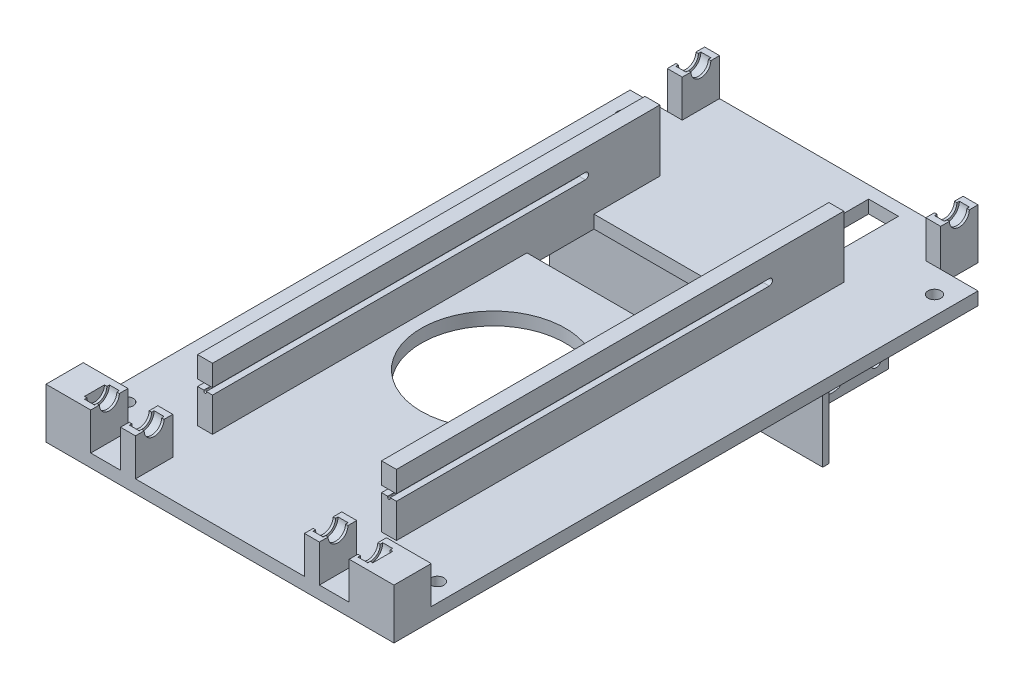
from build123d import *

# Parameters (mm, degrees)
BOSS_EXTRUDE1_DEPTH       = 5.2
SKETCH2_R                 = 29
CUT_EXTRUDE1_DEPTH        = 5.2
SKETCH5_W                 = 6
SKETCH5_H                 = 15
BOSS_EXTRUDE3_DEPTH       = 15
SKETCH8_R                 = 5
CUT_EXTRUDE3_DEPTH        = 2
SKETCH9_R                 = 4
CUT_EXTRUDE4_DEPTH        = 191.628670456
BOSS_EXTRUDE2_DEPTH       = 24.8
CUT_EXTRUDE2_DEPTH        = 183.5
SKETCH15_W                = 68
SKETCH15_H                = 30
CUT_EXTRUDE5_DEPTH        = 10
SKETCH16_W                = 6
SKETCH16_H                = 45
BOSS_EXTRUDE4_DEPTH       = 40
CUT_EXTRUDE6_DEPTH        = 40
SKETCH19_W                = 12
SKETCH19_H                = 40
CUT_EXTRUDE7_DEPTH        = 40
F_5_0MM_DOWEL_HOLE1_D     = 5.2
SKETCH24_W                = 110
SKETCH24_H                = 2.5
BOSS_EXTRUDE5_DEPTH       = 40
SKETCH25_W                = 68
SKETCH25_H                = 5.2
BOSS_EXTRUDE6_DEPTH       = 3
SKETCH26_W                = 18
SKETCH26_H                = 15
SKETCH26_W_2              = 6
BOSS_EXTRUDE7_DEPTH       = 15
SKETCH27_R                = 4
CUT_EXTRUDE8_DEPTH        = 58
SKETCH28_R                = 5
CUT_EXTRUDE9_DEPTH        = 2
LPATTERN1_COUNT           = 2
LPATTERN1_PITCH           = 18
LPATTERN2_COPY_1_SKETCH_R = 5
LPATTERN2_COPY_1_DEPTH    = 2
LPATTERN2_COPY_2_SKETCH_R = 5
LPATTERN2_COPY_2_DEPTH    = 2


with BuildPart() as part:
    # Sketch1 → Boss-Extrude1 (new body)
    with BuildSketch(Plane(origin=(0, 0, 0), x_dir=(1, 0, 0), z_dir=(0, 1, 0))):
        Polygon((-70, -142.5), (70, -142.5), (70, -117.5), (70, 92.5), (55, 92.5), (55, 107.5), (-55, 107.5), (-55, 92.5), (-70, 92.5), (-70, -127.5), align=None)
    extrude(amount=BOSS_EXTRUDE1_DEPTH)

    # Sketch2 → Cut-Extrude1 (cut)
    with BuildSketch(Plane(origin=(0, 5.2, 0), x_dir=(1, 0, 0), z_dir=(0, 1, 0))):
        with Locations((0, -32.5)):
            Circle(SKETCH2_R)
    extrude(amount=-CUT_EXTRUDE1_DEPTH, mode=Mode.SUBTRACT)

    # Sketch5 → Boss-Extrude3 (add)
    with BuildSketch(Plane(origin=(0, 5.2, 0), x_dir=(1, 0, 0), z_dir=(0, 1, 0))):
        with Locations((52, 100)):
            Rectangle(SKETCH5_W, SKETCH5_H)
        with Locations((-52, 100)):
            Rectangle(SKETCH5_W, SKETCH5_H)
    extrude(amount=BOSS_EXTRUDE3_DEPTH)

    # Sketch8 → Cut-Extrude3 (cut, symmetric)
    with BuildSketch(Plane.ZY.offset(52)):
        with Locations((-100, 20.2)):
            Circle(SKETCH8_R)
    cut_extrude3 = extrude(amount=CUT_EXTRUDE3_DEPTH, both=True, mode=Mode.SUBTRACT)

    # Mirror1: Cut-Extrude3 across plane
    add(cut_extrude3.mirror(Plane.ZY), mode=Mode.SUBTRACT)

    # Sketch9 → Cut-Extrude4 (cut, through all)
    with BuildSketch(Plane.ZY.offset(55)):
        with Locations((-100, 20.2)):
            Circle(SKETCH9_R)
    extrude(amount=-CUT_EXTRUDE4_DEPTH, mode=Mode.SUBTRACT)

    # Sketch3 → Boss-Extrude2 (add)
    with BuildSketch(Plane(origin=(0, 5.2, 0), x_dir=(1, 0, 0), z_dir=(0, 1, 0))):
        Polygon((-34, -32.5), (-34, -111.5), (-40, -111.5), (-40, 68.5), (-34, 68.5), align=None)
        Polygon((40, 68.5), (34, 68.5), (34, -32.5), (34, -111.5), (40, -111.5), align=None)
    extrude(amount=BOSS_EXTRUDE2_DEPTH)

    # Sketch4 → Cut-Extrude2 (cut, through all)
    with BuildSketch(Plane(origin=(40, 0, 0), x_dir=(0, 0, -1), z_dir=(1, 0, 0))):
        with BuildLine():
            Line((-111.5, 21.5), (38.5, 21.5))
            ThreePointArc((38.5, 21.5), (39.8, 20.2), (38.5, 18.9))
            Line((38.5, 18.9), (-111.5, 18.9))
            ThreePointArc((-111.5, 18.9), (-112.8, 20.2), (-111.5, 21.5))
        make_face()
    extrude(amount=-CUT_EXTRUDE2_DEPTH, mode=Mode.SUBTRACT)

    # Cut-Sweep4: sweep along a curve in space
    with BuildLine() as cut_sweep4_path:
        Line((40, 18.9, 111.5), (40, 18.9, -38.5))
    # Sketch10 → Cut-Sweep4 (sweep, cut)
    with BuildSketch(Plane.XY.offset(111.5)):
        with BuildLine():
            Line((36.5, 18.5), (36.5, 18.9))
            Line((36.5, 18.9), (37.5, 18.9))
            Line((37.5, 18.9), (37.5, 18.5))
            ThreePointArc((37.5, 18.5), (37, 18), (36.5, 18.5))
        make_face()
    cut_sweep4 = sweep(path=cut_sweep4_path.line, mode=Mode.SUBTRACT)

    # Mirror2: Cut-Sweep4 across plane
    add(cut_sweep4.mirror(Plane.ZY), mode=Mode.SUBTRACT)

    # Sketch15 → Cut-Extrude5 (cut)
    with BuildSketch(Plane(origin=(0, 5.2, 0), x_dir=(1, 0, 0), z_dir=(0, 1, 0))):
        with Locations((0, 30)):
            Rectangle(SKETCH15_W, SKETCH15_H)
    extrude(amount=-CUT_EXTRUDE5_DEPTH, mode=Mode.SUBTRACT)

    # Sketch16 → Boss-Extrude4 (add)
    with BuildSketch(Plane.XZ):
        with Locations((31, -70)):
            Rectangle(SKETCH16_W, SKETCH16_H)
    extrude(amount=BOSS_EXTRUDE4_DEPTH)

    # Sketch17 → Cut-Extrude6 (cut)
    with BuildSketch(Plane.ZY.offset(-28)):
        with BuildLine():
            Line((-85.4, -5), (-85.4, -35))
            ThreePointArc((-85.4, -35), (-87.5, -37.1), (-89.6, -35))
            Line((-89.6, -35), (-89.6, -5))
            ThreePointArc((-89.6, -5), (-87.5, -2.9), (-85.4, -5))
        make_face()
        with BuildLine():
            Line((-50.4, -5), (-50.4, -35))
            ThreePointArc((-50.4, -35), (-52.5, -37.1), (-54.6, -35))
            Line((-54.6, -35), (-54.6, -5))
            ThreePointArc((-54.6, -5), (-52.5, -2.9), (-50.4, -5))
        make_face()
        with BuildLine():
            Line((-63, -10), (-63, -30))
            ThreePointArc((-63, -30), (-70, -37), (-77, -30))
            Line((-77, -30), (-77, -10))
            ThreePointArc((-77, -10), (-70, -3), (-63, -10))
        make_face()
    extrude(amount=-CUT_EXTRUDE6_DEPTH, mode=Mode.SUBTRACT)

    # Sketch19 → Cut-Extrude7 (cut)
    with BuildSketch(Plane.XZ):
        with Locations((22, -82.5)):
            Rectangle(SKETCH19_W, SKETCH19_H)
    extrude(amount=-CUT_EXTRUDE7_DEPTH, mode=Mode.SUBTRACT)

    # Ø5.0mm Dowel Hole1 (through all)
    with Locations(Plane(origin=(0, 5.2, 0), x_dir=(1, 0, 0), z_dir=(0, 1, 0))):
        with Locations((-62.5, 82.5), (62.5, 82.5), (62.5, -117.5), (-62.5, -117.5)):
            Hole(F_5_0MM_DOWEL_HOLE1_D / 2)

    # Sketch24 → Boss-Extrude5 (add)
    with BuildSketch(Plane.XZ):
        with Locations((0, -46.25)):
            Rectangle(SKETCH24_W, SKETCH24_H)
    extrude(amount=BOSS_EXTRUDE5_DEPTH)

    # Sketch25 → Boss-Extrude6 (add)
    with BuildSketch(Plane.XY.offset(-45)):
        with Locations((0, 2.6)):
            Rectangle(SKETCH25_W, SKETCH25_H)
    extrude(amount=BOSS_EXTRUDE6_DEPTH)

    # Sketch26 → Boss-Extrude7 (add)
    with BuildSketch(Plane(origin=(0, 5.2, 0), x_dir=(1, 0, 0), z_dir=(0, 1, 0))):
        with Locations((-61, -135)):
            Rectangle(SKETCH26_W, SKETCH26_H)
        with Locations((61, -135)):
            Rectangle(SKETCH26_W, SKETCH26_H)
        with Locations((-37, -135)):
            Rectangle(SKETCH26_W_2, SKETCH26_H)
        with Locations((37, -135)):
            Rectangle(SKETCH26_W_2, SKETCH26_H)
    extrude(amount=BOSS_EXTRUDE7_DEPTH)

    # Sketch27 → Cut-Extrude8 (cut, symmetric)
    with BuildSketch(Plane.ZY):
        with Locations((135, 20.2)):
            Circle(SKETCH27_R)
    extrude(amount=CUT_EXTRUDE8_DEPTH, both=True, mode=Mode.SUBTRACT)

    # Sketch28 → Cut-Extrude9 (cut, symmetric)
    with BuildSketch(Plane(origin=(-55, 0, 0), x_dir=(0, 0, -1), z_dir=(1, 0, 0))):
        with Locations((-135, 20.2)):
            Circle(SKETCH28_R)
    cut_extrude9 = extrude(amount=CUT_EXTRUDE9_DEPTH, both=True, mode=Mode.SUBTRACT)

    # LPattern1: Cut-Extrude9 ×2
    with Locations(*[(i * LPATTERN1_PITCH, 0, 0) for i in range(1, LPATTERN1_COUNT)]):
        add(cut_extrude9, mode=Mode.SUBTRACT)

    # LPattern2 copy 1 sketch → LPattern2 copy 1 (cut, symmetric)
    with BuildSketch(Plane(origin=(55, 0, 0), x_dir=(0, 0, -1), z_dir=(1, 0, 0))):
        with Locations((-135, 20.2)):
            Circle(LPATTERN2_COPY_1_SKETCH_R)
    extrude(amount=LPATTERN2_COPY_1_DEPTH, both=True, mode=Mode.SUBTRACT)

    # LPattern2 copy 2 sketch → LPattern2 copy 2 (cut, symmetric)
    with BuildSketch(Plane(origin=(37, 0, 0), x_dir=(0, 0, -1), z_dir=(1, 0, 0))):
        with Locations((-135, 20.2)):
            Circle(LPATTERN2_COPY_2_SKETCH_R)
    extrude(amount=LPATTERN2_COPY_2_DEPTH, both=True, mode=Mode.SUBTRACT)


solid = part.part
